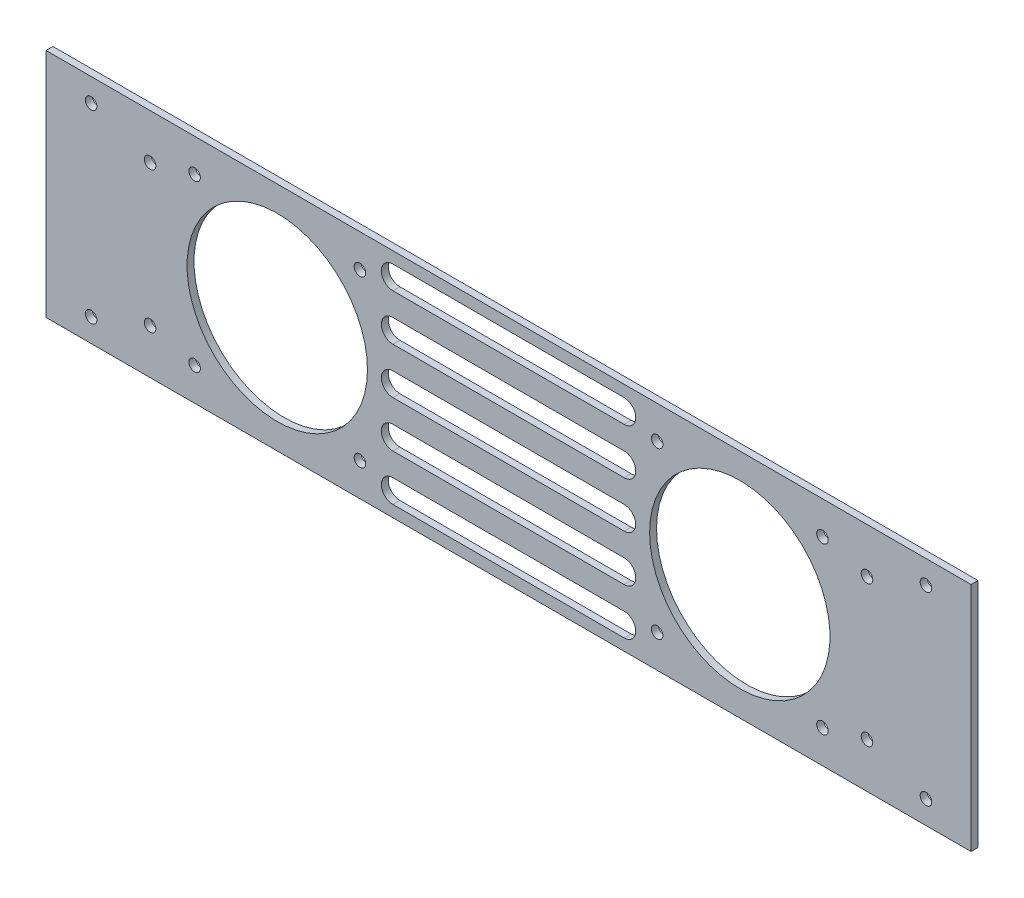
from build123d import *

# Parameters (mm, degrees)
SKETCH1_W           = 400
SKETCH1_H           = 100
BOSS_EXTRUDE1_DEPTH = 3
SKETCH2_R           = 2.5
SKETCH2_R_2         = 39
CUT_EXTRUDE1_DEPTH  = 207.177108332
CUT_EXTRUDE2_DEPTH  = 207.177108332
CUT_EXTRUDE3_REACH  = 208.177
SKETCH4_R           = 2.5
SKETCH5_R           = 2.5
CUT_EXTRUDE4_DEPTH  = 207.177108332


with BuildPart() as part:
    # Sketch1 → Boss-Extrude1 (new body)
    with BuildSketch(Plane.XY):
        Rectangle(SKETCH1_W, SKETCH1_H)
    extrude(amount=BOSS_EXTRUDE1_DEPTH)

    # Sketch2 → Cut-Extrude1 (cut, through all)
    with BuildSketch(Plane.XY.offset(3)):
        with Locations((-64.25, 35.75)):
            Circle(SKETCH2_R)
        with Locations((-64.25, -35.75)):
            Circle(SKETCH2_R)
        with Locations((-135.75, -35.75)):
            Circle(SKETCH2_R)
        with Locations((-135.75, 35.75)):
            Circle(SKETCH2_R)
        with Locations((-100, 0)):
            Circle(SKETCH2_R_2)
        with Locations((100, 0)):
            Circle(SKETCH2_R_2)
        with Locations((135.75, 35.75)):
            Circle(SKETCH2_R)
        with Locations((135.75, -35.75)):
            Circle(SKETCH2_R)
        with Locations((64.25, -35.75)):
            Circle(SKETCH2_R)
        with Locations((64.25, 35.75)):
            Circle(SKETCH2_R)
    extrude(amount=-CUT_EXTRUDE1_DEPTH, mode=Mode.SUBTRACT)

    # Sketch3 → Cut-Extrude2 (cut, through all)
    with BuildSketch(Plane.XY.offset(3)):
        with BuildLine():
            Line((-50, 5), (50, 5))
            ThreePointArc((50, 5), (55, 0), (50, -5))
            Line((50, -5), (-50, -5))
            ThreePointArc((-50, -5), (-55, 0), (-50, 5))
        make_face()
        with BuildLine():
            Line((-50, 25), (50, 25))
            ThreePointArc((50, 25), (55, 20), (50, 15))
            Line((50, 15), (-50, 15))
            ThreePointArc((-50, 15), (-55, 20), (-50, 25))
        make_face()
        with BuildLine():
            Line((-50, 45), (50, 45))
            ThreePointArc((50, 45), (55, 40), (50, 35))
            Line((50, 35), (-50, 35))
            ThreePointArc((-50, 35), (-55, 40), (-50, 45))
        make_face()
        with BuildLine():
            Line((-50, -45), (50, -45))
            ThreePointArc((50, -45), (55, -40), (50, -35))
            Line((50, -35), (-50, -35))
            ThreePointArc((-50, -35), (-55, -40), (-50, -45))
        make_face()
        with BuildLine():
            Line((-50, -25), (50, -25))
            ThreePointArc((50, -25), (55, -20), (50, -15))
            Line((50, -15), (-50, -15))
            ThreePointArc((-50, -15), (-55, -20), (-50, -25))
        make_face()
    extrude(amount=-CUT_EXTRUDE2_DEPTH, mode=Mode.SUBTRACT)

    # Sketch4 → Cut-Extrude3 (cut, up to next)
    with BuildSketch(Plane.XY.offset(3), mode=Mode.PRIVATE) as cut_extrude3_sk1:
        with Locations((-155, -30.5)):
            Circle(SKETCH4_R)
    cut_extrude3_tool1 = extrude(cut_extrude3_sk1.sketch, amount=-CUT_EXTRUDE3_REACH, mode=Mode.PRIVATE) & part.part
    # Sketch4 → Cut-Extrude3 (cut, up to next)
    with BuildSketch(Plane.XY.offset(3), mode=Mode.PRIVATE) as cut_extrude3_sk2:
        with Locations((-155, 30.5)):
            Circle(SKETCH4_R)
    cut_extrude3_tool2 = extrude(cut_extrude3_sk2.sketch, amount=-CUT_EXTRUDE3_REACH, mode=Mode.PRIVATE) & part.part
    # Sketch4 → Cut-Extrude3 (cut, up to next)
    with BuildSketch(Plane.XY.offset(3), mode=Mode.PRIVATE) as cut_extrude3_sk3:
        with Locations((155, 30.5)):
            Circle(SKETCH4_R)
    cut_extrude3_tool3 = extrude(cut_extrude3_sk3.sketch, amount=-CUT_EXTRUDE3_REACH, mode=Mode.PRIVATE) & part.part
    # Sketch4 → Cut-Extrude3 (cut, up to next)
    with BuildSketch(Plane.XY.offset(3), mode=Mode.PRIVATE) as cut_extrude3_sk4:
        with Locations((155, -30.5)):
            Circle(SKETCH4_R)
    cut_extrude3_tool4 = extrude(cut_extrude3_sk4.sketch, amount=-CUT_EXTRUDE3_REACH, mode=Mode.PRIVATE) & part.part
    add(cut_extrude3_tool1.solids().sort_by_distance((-155, -30.5, 3))[0], mode=Mode.SUBTRACT)
    add(cut_extrude3_tool2.solids().sort_by_distance((-155, 30.5, 3))[0], mode=Mode.SUBTRACT)
    add(cut_extrude3_tool3.solids().sort_by_distance((155, 30.5, 3))[0], mode=Mode.SUBTRACT)
    add(cut_extrude3_tool4.solids().sort_by_distance((155, -30.5, 3))[0], mode=Mode.SUBTRACT)

    # Sketch5 → Cut-Extrude4 (cut, through all)
    with BuildSketch(Plane.XY.offset(3)):
        with Locations((-180.5, -40)):
            Circle(SKETCH5_R)
        with Locations((-180.5, 40)):
            Circle(SKETCH5_R)
        with Locations((180.5, 40)):
            Circle(SKETCH5_R)
        with Locations((180.5, -40)):
            Circle(SKETCH5_R)
    extrude(amount=-CUT_EXTRUDE4_DEPTH, mode=Mode.SUBTRACT)


solid = part.part
